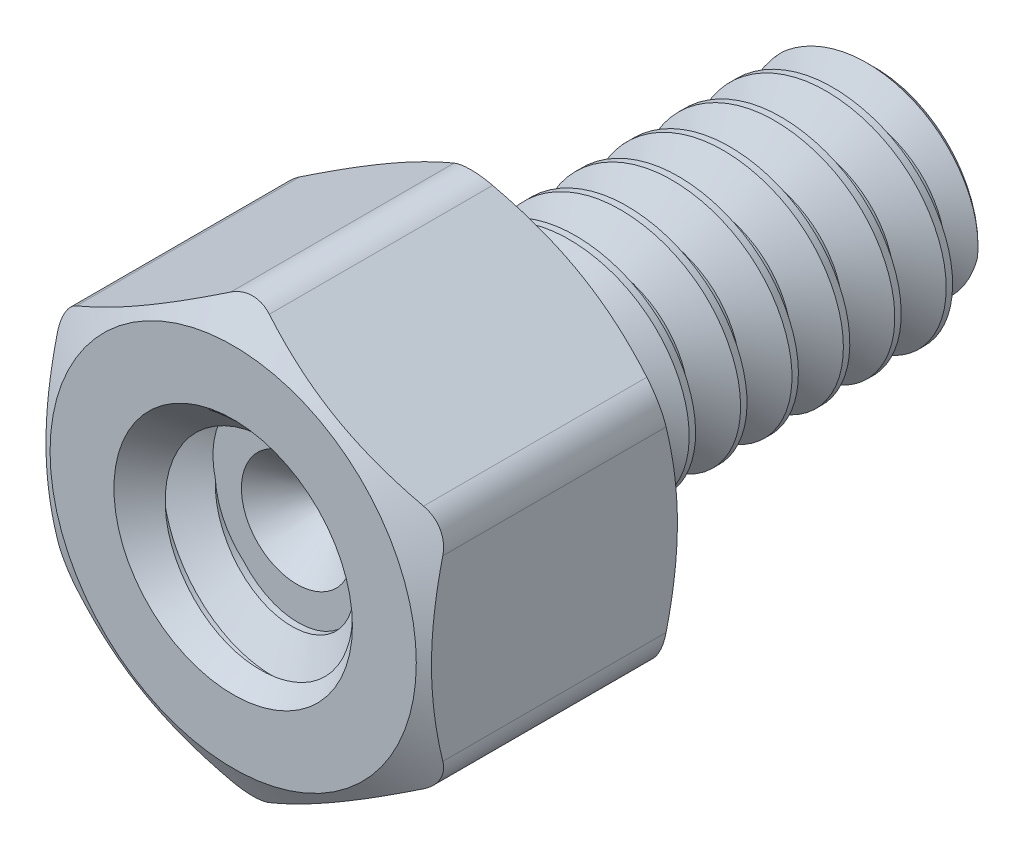
from build123d import *

# Parameters (mm, degrees)
SKETCH4_R           = 1.901825
BOSS_EXTRUDE1_DEPTH = 3.175
SKETCH5_OUTSIDE_W   = 42.626
SKETCH5_OUTSIDE_H   = 43.364
SKETCH5_OUTSIDE_R   = 2.2621875
CUT_EXTRUDE1_DEPTH  = 9.73125
CUT_EXTRUDE1_DRAFT  = -60
SKETCH6_OUTSIDE_W   = 33.138
SKETCH6_OUTSIDE_H   = 33.876
SKETCH6_OUTSIDE_R   = 2.2621875
CUT_EXTRUDE2_DEPTH  = 6.992681083
CUT_EXTRUDE2_DRAFT  = -60
FILLET1_R           = 0.47625
CUT_SWEEP1_PITCH    = 0.635
SKETCH9_R           = 1.58115
BOSS_EXTRUDE2_DEPTH = 0.7874
SKETCH10_W          = 0.7874
SKETCH10_H          = 1.4224
CUT_SWEEP2_PITCH    = 0.635


with BuildPart() as part:
    # Sketch3 → Revolve1 (revolve)
    with BuildSketch(Plane(origin=(0, 0, 0), x_dir=(0, 0, -1), z_dir=(1, 0, 0))):
        with BuildLine():
            Line((-2.3876, 1.26365), (-2.3876, 0))
            Line((-2.3876, 0), (4.7625, 0))
            Line((4.7625, 0), (4.7625, 1.26365))
            Line((4.7625, 1.26365), (4.60375, 1.4224))
            Line((4.60375, 1.4224), (0.809625, 1.4224))
            Line((0.809625, 1.4224), (0.5715, 1.009955401))
            Line((0.5715, 1.009955401), (0.15875, 1.009955401))
            ThreePointArc((0.15875, 1.009955401), (0.046496798, 1.0564522), (0, 1.168705401))
            Line((0, 1.168705401), (0, 2.38125))
            Line((0, 2.38125), (-3.175, 2.38125))
            Line((-3.175, 2.38125), (-3.175, 1.58115))
            Line((-3.175, 1.58115), (-3.01625, 1.4224))
            Line((-3.01625, 1.4224), (-2.54635, 1.4224))
            Line((-2.54635, 1.4224), (-2.3876, 1.26365))
        make_face()
    revolve(axis=Axis((0, 0, -4.7625), (0, 0, 1)))

    # Sketch4 → Boss-Extrude1 (add)
    with BuildSketch(Plane.XY.offset(3.175)):
        Polygon((-2.38125, 1.374815329), (-2.38125, -1.374815329), (0, -2.749630657), (2.38125, -1.374815329), (2.38125, 1.374815329), (0, 2.749630657), align=None)
        Circle(SKETCH4_R, mode=Mode.SUBTRACT)
    extrude(amount=-BOSS_EXTRUDE1_DEPTH)


with BuildPart() as cut_extrude1_tool:
    # Sketch5 outside → Cut-Extrude1 (with draft: the straight prism first)
    with BuildSketch(Plane.XY.offset(3.175)):
        Rectangle(SKETCH5_OUTSIDE_W, SKETCH5_OUTSIDE_H)
        Circle(SKETCH5_OUTSIDE_R, mode=Mode.SUBTRACT)
    extrude(amount=-CUT_EXTRUDE1_DEPTH)
    # Cut-Extrude1: the draft: its side faces are tilted about the plane it starts from
    cut_extrude1_sides = [cut_extrude1_tool.faces().sort_by_distance(p)[0] for p in [
        (0, -21.682, -1.690625),
        (21.313, 0, -1.690625),
        (0, 21.682, -1.690625),
        (-21.313, 0, -1.690625),
        (-2.2621875, 0, -1.690625),
    ]]
    draft(cut_extrude1_sides, Plane.XY.offset(3.175), CUT_EXTRUDE1_DRAFT)


with BuildPart() as part_1:
    add(part.part)

    # Cut-Extrude1: cut by cut_extrude1_tool
    add(cut_extrude1_tool.part, mode=Mode.SUBTRACT)


with BuildPart() as cut_extrude2_tool:
    # Sketch6 outside → Cut-Extrude2 (with draft: the straight prism first)
    with BuildSketch(Plane(origin=(0, 0, 0), x_dir=(-1, 0, 0), z_dir=(0, 0, -1))):
        Rectangle(SKETCH6_OUTSIDE_W, SKETCH6_OUTSIDE_H)
        Circle(SKETCH6_OUTSIDE_R, mode=Mode.SUBTRACT)
    extrude(amount=-CUT_EXTRUDE2_DEPTH)
    # Cut-Extrude2: the draft: its side faces are tilted about the plane it starts from
    cut_extrude2_sides = [cut_extrude2_tool.faces().sort_by_distance(p)[0] for p in [
        (0, -16.938, 3.496340541),
        (-16.569, 0, 3.496340541),
        (0, 16.938, 3.496340541),
        (16.569, 0, 3.496340541),
        (2.2621875, 0, 3.496340541),
    ]]
    draft(cut_extrude2_sides, Plane(origin=(0, 0, 0), x_dir=(-1, 0, 0), z_dir=(0, 0, -1)), CUT_EXTRUDE2_DRAFT)


with BuildPart() as part_2:
    add(part_1.part)

    # Cut-Extrude2: cut by cut_extrude2_tool
    add(cut_extrude2_tool.part, mode=Mode.SUBTRACT)

    # Fillet1
    fillet1_edges = [part_2.edges().sort_by_distance(p)[0] for p in [
        (0, 2.749630657, 1.5875),
        (-2.38125, -1.374815329, 1.5875),
        (0, -2.749630657, 1.5875),
        (2.38125, -1.374815329, 1.5875),
        (2.38125, 1.374815329, 1.5875),
        (-2.38125, 1.374815329, 1.5875),
    ]]
    fillet(fillet1_edges, radius=FILLET1_R)

    # Cut-Sweep1: the profile of Sketch7 profile screwed along a right-hand helix of 7.275 turns, 6 arcs to a turn; built about Z, then put on its axis
    cut_sweep1_z = Axis((0, 0, 0), (0, 0, 1))
    cut_sweep1_corners = [(1.009655401, 0, -0.238298205), (1.009655401, 0, -0.317326795), (1.456770383, 0, -0.57546875), (1.456770383, 0, 0.01984375)]
    with BuildLine(mode=Mode.PRIVATE) as cut_sweep1_profile:
        Line(cut_sweep1_corners[0], cut_sweep1_corners[1])
        Line(cut_sweep1_corners[1], cut_sweep1_corners[2])
        Line(cut_sweep1_corners[2], cut_sweep1_corners[3])
        Line(cut_sweep1_corners[3], cut_sweep1_corners[0])
    cut_sweep1_cap = Face(cut_sweep1_profile.wire())
    cut_sweep1_turn_angles = [0, 30, 60, 90, 120, 150, 180, 210, 240, 270, 300, 330, 360]
    cut_sweep1_turn_weights = [1, 0.8660254037844387, 1, 0.8660254037844387, 1, 0.8660254037844387, 1, 0.8660254037844387, 1, 0.8660254037844387, 1, 0.8660254037844387, 1]
    cut_sweep1_turn_rails = [Edge.make_bspline([Vector(p[0], p[1], 0).rotate(cut_sweep1_z, cut_sweep1_turn_angles[k]) / cut_sweep1_turn_weights[k] + Vector(0, 0, p[2] + CUT_SWEEP1_PITCH * cut_sweep1_turn_angles[k] / 360) for k in range(13)], [0, 0, 0, 1, 1, 2, 2, 3, 3, 4, 4, 5, 5, 6, 6, 6], 2, cut_sweep1_turn_weights) for p in cut_sweep1_corners]
    cut_sweep1_turn_sides = [Face.make_surface_from_curves(cut_sweep1_turn_rails[p[0]], cut_sweep1_turn_rails[p[1]]) for p in [(0, 1), (1, 2), (2, 3), (3, 0)]]
    cut_sweep1_last_angles = [2520, 2550, 2580, 2599.5, 2619]
    cut_sweep1_last_weights = [1, 0.8660254037844387, 1, 0.9426414910921863, 1]
    cut_sweep1_last_rails = [Edge.make_bspline([Vector(p[0], p[1], 0).rotate(cut_sweep1_z, cut_sweep1_last_angles[k]) / cut_sweep1_last_weights[k] + Vector(0, 0, p[2] + CUT_SWEEP1_PITCH * cut_sweep1_last_angles[k] / 360) for k in range(5)], [0, 0, 0, 1, 1, 2, 2, 2], 2, cut_sweep1_last_weights) for p in cut_sweep1_corners]
    cut_sweep1_last_sides = [Face.make_surface_from_curves(cut_sweep1_last_rails[p[0]], cut_sweep1_last_rails[p[1]]) for p in [(0, 1), (1, 2), (2, 3), (3, 0)]]
    cut_sweep1 = Plane(origin=(0, 0, -4.7625), x_dir=(0, 1, 0), z_dir=(0, 0, 1)) * Solid(Shell([*[p.moved(Location((0, 0, CUT_SWEEP1_PITCH * i))) for i in range(7) for p in cut_sweep1_turn_sides], *cut_sweep1_last_sides, cut_sweep1_cap, cut_sweep1_cap.rotate(cut_sweep1_z, 2619).moved(Location((0, 0, CUT_SWEEP1_PITCH * 2619 / 360)))]))
    add(cut_sweep1, mode=Mode.SUBTRACT)

    # Sketch9 → Boss-Extrude2 (add)
    with BuildSketch(Plane.XY.offset(2.3876)):
        Circle(SKETCH9_R)
    extrude(amount=BOSS_EXTRUDE2_DEPTH)


with BuildPart() as body_2:
    # Sketch10 → Revolve2 (revolve)
    with BuildSketch(Plane(origin=(0, 0, 0), x_dir=(0, 0, -1), z_dir=(1, 0, 0))):
        with Locations((-2.7813, 0.7112)):
            Rectangle(SKETCH10_W, SKETCH10_H)
    revolve(axis=Axis((0, 0, -4.7625), (0, 0, 1)))

    # Cut-Sweep2: the profile of Sketch12 profile screwed along a right-hand helix of 2.24 turns, 6 arcs to a turn; built about Z, then put on its axis
    cut_sweep2_z = Axis((0, 0, 0), (0, 0, 1))
    cut_sweep2_corners = [(1.009655401, 0, -0.317326795), (1.009655401, 0, -0.238298205), (1.456770383, 0, 0.01984375), (1.456770383, 0, -0.57546875)]
    with BuildLine(mode=Mode.PRIVATE) as cut_sweep2_profile:
        Line(cut_sweep2_corners[0], cut_sweep2_corners[1])
        Line(cut_sweep2_corners[1], cut_sweep2_corners[2])
        Line(cut_sweep2_corners[2], cut_sweep2_corners[3])
        Line(cut_sweep2_corners[3], cut_sweep2_corners[0])
    cut_sweep2_cap = Face(cut_sweep2_profile.wire())
    cut_sweep2_turn_angles = [0, 30, 60, 90, 120, 150, 180, 210, 240, 270, 300, 330, 360]
    cut_sweep2_turn_weights = [1, 0.8660254037844387, 1, 0.8660254037844387, 1, 0.8660254037844387, 1, 0.8660254037844387, 1, 0.8660254037844387, 1, 0.8660254037844387, 1]
    cut_sweep2_turn_rails = [Edge.make_bspline([Vector(p[0], p[1], 0).rotate(cut_sweep2_z, cut_sweep2_turn_angles[k]) / cut_sweep2_turn_weights[k] + Vector(0, 0, p[2] + CUT_SWEEP2_PITCH * cut_sweep2_turn_angles[k] / 360) for k in range(13)], [0, 0, 0, 1, 1, 2, 2, 3, 3, 4, 4, 5, 5, 6, 6, 6], 2, cut_sweep2_turn_weights) for p in cut_sweep2_corners]
    cut_sweep2_turn_sides = [Face.make_surface_from_curves(cut_sweep2_turn_rails[p[0]], cut_sweep2_turn_rails[p[1]]) for p in [(0, 1), (1, 2), (2, 3), (3, 0)]]
    cut_sweep2_last_angles = [720, 750, 780, 793.2, 806.4]
    cut_sweep2_last_weights = [1, 0.8660254037844387, 1, 0.9735789028731574, 1]
    cut_sweep2_last_rails = [Edge.make_bspline([Vector(p[0], p[1], 0).rotate(cut_sweep2_z, cut_sweep2_last_angles[k]) / cut_sweep2_last_weights[k] + Vector(0, 0, p[2] + CUT_SWEEP2_PITCH * cut_sweep2_last_angles[k] / 360) for k in range(5)], [0, 0, 0, 1, 1, 2, 2, 2], 2, cut_sweep2_last_weights) for p in cut_sweep2_corners]
    cut_sweep2_last_sides = [Face.make_surface_from_curves(cut_sweep2_last_rails[p[0]], cut_sweep2_last_rails[p[1]]) for p in [(0, 1), (1, 2), (2, 3), (3, 0)]]
    cut_sweep2 = Plane(origin=(0, 0, 3.175), x_dir=(0, 1, 0), z_dir=(0, 0, -1)) * Solid(Shell([*[p.moved(Location((0, 0, CUT_SWEEP2_PITCH * i))) for i in range(2) for p in cut_sweep2_turn_sides], *cut_sweep2_last_sides, cut_sweep2_cap, cut_sweep2_cap.rotate(cut_sweep2_z, 806.4).moved(Location((0, 0, CUT_SWEEP2_PITCH * 806.4 / 360)))]))
    add(cut_sweep2, mode=Mode.SUBTRACT)


with BuildPart() as part_3:
    add(part_2.part)

    # Combine1: cut body 2
    add(body_2.part, mode=Mode.SUBTRACT)

    # Cut-Extrude3 cone 1 section (through the dimple's axis) → Cut-Extrude3 (revolve, cut)
    with BuildSketch(Plane(origin=(0, 0, 3.175), x_dir=(0, -1, 0), z_dir=(1, 0, 0))):
        Polygon((0, 0), (1.4732, 0), (0, 1.4732), align=None)
    revolve(axis=Axis((0, 0, 3.175), (0, 0, -1)), mode=Mode.SUBTRACT)


solid = part_3.part
